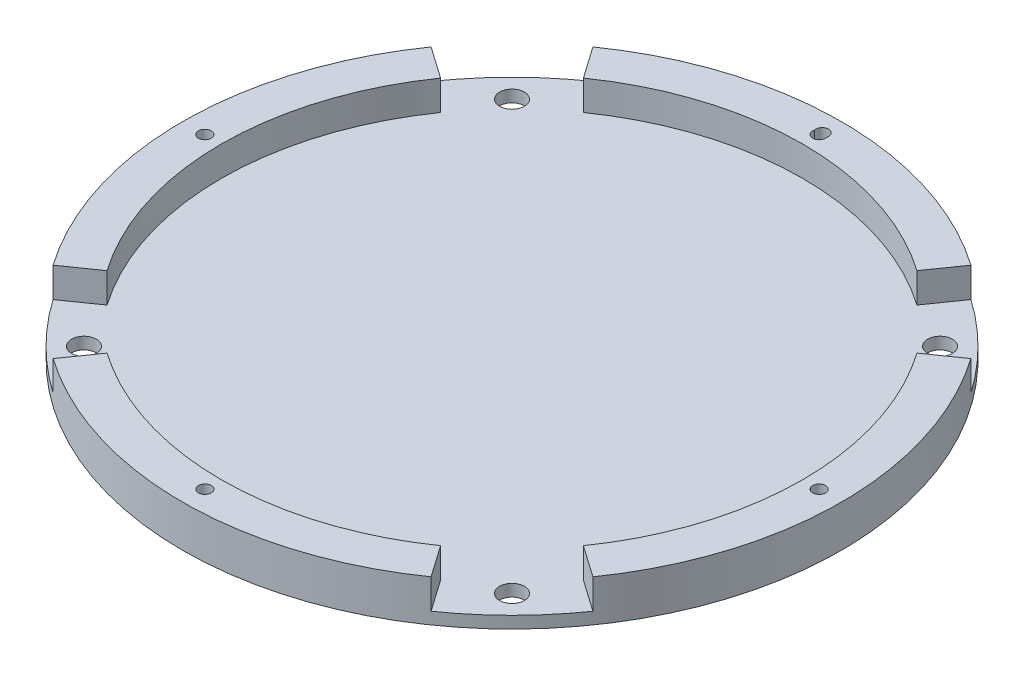
from build123d import *

# Parameters (mm, degrees)
SCHIZZO1_R                       = 110.5
SCHIZZO1_R_2                     = 2.15
SCHIZZO1_R_3                     = 4.15
ESTRUSIONE_ESTRUSIONE1_DEPTH     = 4
ESTRUSIONE_ESTRUSIONE2_OUTLINE_R = 2.15
ESTRUSIONE_ESTRUSIONE2_DEPTH     = 10


# Read off the part's stored shape, not the designer's step: Estrusione-Estrusione2
with BuildPart() as part:
    # Schizzo1 → Estrusione-Estrusione1 (new body)
    with BuildSketch(Plane(origin=(0, 0, 0), x_dir=(1, 0, 0), z_dir=(0, 1, 0))):
        with Locations(Location((0, 0, 0), (0, 0, 270))):
            Circle(SCHIZZO1_R)
        with Locations(Location((-103, 0, 0), (0, 0, 270))):
            Circle(SCHIZZO1_R_2, mode=Mode.SUBTRACT)
        with Locations(Location((0, 103, 0), (0, 0, 270))):
            Circle(SCHIZZO1_R_2, mode=Mode.SUBTRACT)
        with Locations(Location((103, 0, 0), (0, 0, 270))):
            Circle(SCHIZZO1_R_2, mode=Mode.SUBTRACT)
        with Locations(Location((0, -103, 0), (0, 0, 270))):
            Circle(SCHIZZO1_R_2, mode=Mode.SUBTRACT)
        with Locations(Location((-71.77133829, 71.77133829, 0), (0, 0, 270))):
            Circle(SCHIZZO1_R_3, mode=Mode.SUBTRACT)
        with Locations(Location((71.77133829, 71.77133829, 0), (0, 0, 270))):
            Circle(SCHIZZO1_R_3, mode=Mode.SUBTRACT)
        with Locations(Location((71.77133829, -71.77133829, 0), (0, 0, 270))):
            Circle(SCHIZZO1_R_3, mode=Mode.SUBTRACT)
        with Locations(Location((-71.77133829, -71.77133829, 0), (0, 0, 270))):
            Circle(SCHIZZO1_R_3, mode=Mode.SUBTRACT)
    extrude(amount=ESTRUSIONE_ESTRUSIONE1_DEPTH)

    # Estrusione-Estrusione2 outline → Estrusione-Estrusione2 (add)
    # profile 1 of 4: a face of its own
    with BuildSketch(Plane(origin=(0, 4, 0), x_dir=(1, 0, 0), z_dir=(0, 1, 0))):
        with BuildLine():
            ThreePointArc((90.516300894, -63.380196217), (110.5, 0), (90.516300894, 63.380196217))
            Line((90.516300894, 63.380196217), (79.867324318, 55.923702544))
            ThreePointArc((79.867324318, 55.923702544), (97.5, 0), (79.867324318, -55.923702544))
            Line((79.867324318, -55.923702544), (90.516300894, -63.380196217))
        make_face()
        with Locations((103, 0)):
            Circle(ESTRUSIONE_ESTRUSIONE2_OUTLINE_R, mode=Mode.SUBTRACT)
    # profile 2 of 4: a face of its own
    with BuildSketch(Plane(origin=(0, 4, 0), x_dir=(1, 0, 0), z_dir=(0, 1, 0))):
        with BuildLine():
            Line((55.923702544, 79.867324318), (63.380196217, 90.516300894))
            ThreePointArc((63.380196217, 90.516300894), (0, 110.5), (-63.380196217, 90.516300894))
            Line((-63.380196217, 90.516300894), (-55.923702544, 79.867324318))
            ThreePointArc((-55.923702544, 79.867324318), (0, 97.5), (55.923702544, 79.867324318))
        make_face()
        with BuildLine():
            ThreePointArc((2.091052367, 103.5), (0, 100.85), (-2.091052367, 103.5))
            ThreePointArc((-2.091052367, 103.5), (0, 106.15), (2.091052367, 103.5))
        make_face(mode=Mode.SUBTRACT)
    # profile 3 of 4: a face of its own
    with BuildSketch(Plane(origin=(0, 4, 0), x_dir=(1, 0, 0), z_dir=(0, 1, 0))):
        with BuildLine():
            ThreePointArc((-63.380196217, -90.516300894), (0, -110.5), (63.380196217, -90.516300894))
            Line((63.380196217, -90.516300894), (55.923702544, -79.867324318))
            ThreePointArc((55.923702544, -79.867324318), (0, -97.5), (-55.923702544, -79.867324318))
            Line((-55.923702544, -79.867324318), (-63.380196217, -90.516300894))
        make_face()
        with Locations((0, -103)):
            Circle(ESTRUSIONE_ESTRUSIONE2_OUTLINE_R, mode=Mode.SUBTRACT)
    # profile 4 of 4: a face of its own
    with BuildSketch(Plane(origin=(0, 4, 0), x_dir=(1, 0, 0), z_dir=(0, 1, 0))):
        with BuildLine():
            Line((-79.867324318, 55.923702544), (-90.516300894, 63.380196217))
            ThreePointArc((-90.516300894, 63.380196217), (-110.5, 0), (-90.516300894, -63.380196217))
            Line((-90.516300894, -63.380196217), (-79.867324318, -55.923702544))
            ThreePointArc((-79.867324318, -55.923702544), (-97.5, 0), (-79.867324318, 55.923702544))
        make_face()
        with Locations((-103, 0)):
            Circle(ESTRUSIONE_ESTRUSIONE2_OUTLINE_R, mode=Mode.SUBTRACT)
    extrude(amount=ESTRUSIONE_ESTRUSIONE2_DEPTH)


solid = part.part
